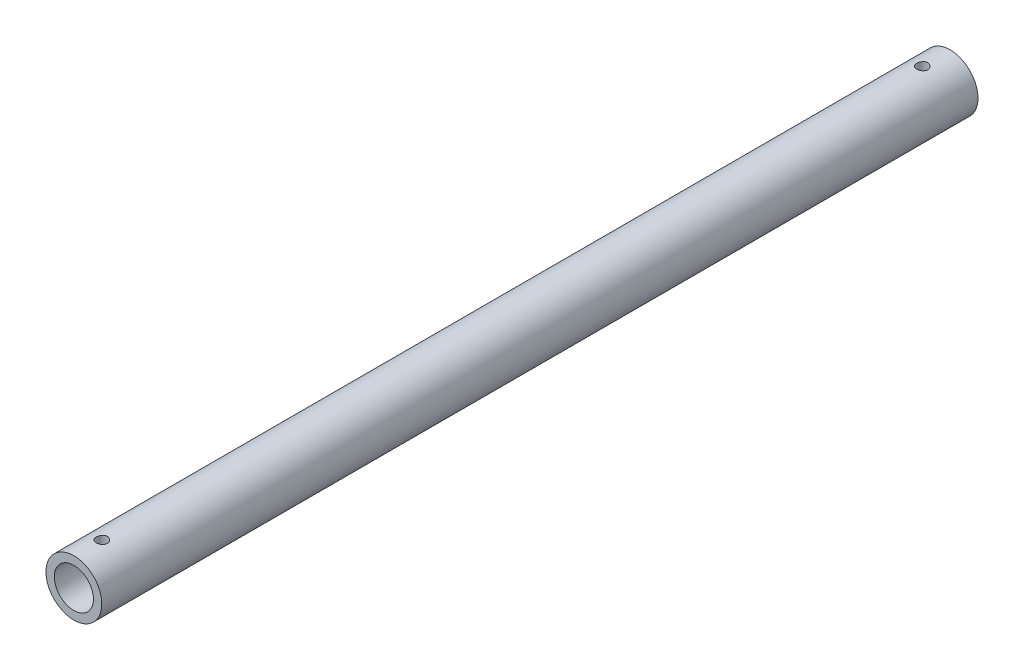
from build123d import *

# Parameters (mm, degrees)
ESQUISSE1_R                  = 5
ESQUISSE1_R_2                = 3.505
BOSS_EXTRU_1_DEPTH           = 157
ENL_V_MAT_EXTRU_1_DEPTH      = 10
ENL_V_MAT_EXTRU_1_DEPTH_BACK = 10
ESQUISSE2_R                  = 1


with BuildPart() as part:
    # Esquisse1 → Boss.-Extru.1 (new body)
    with BuildSketch(Plane.XY):
        Circle(ESQUISSE1_R)
        Circle(ESQUISSE1_R_2, mode=Mode.SUBTRACT)
    extrude(amount=BOSS_EXTRU_1_DEPTH)

    # Esquisse2 → Enlèv. mat.-Extru.1 (cut, two sides: drawn at the far end of the back side and taken through both)
    with BuildSketch(Plane(origin=(0, 0, 0), x_dir=(1, 0, 0), z_dir=(0, 1, 0)).offset(-ENL_V_MAT_EXTRU_1_DEPTH_BACK)):
        with Locations((0, -152)):
            Circle(ESQUISSE2_R)
        with Locations((0, -5)):
            Circle(ESQUISSE2_R)
    extrude(amount=ENL_V_MAT_EXTRU_1_DEPTH + ENL_V_MAT_EXTRU_1_DEPTH_BACK, mode=Mode.SUBTRACT)


solid = part.part
